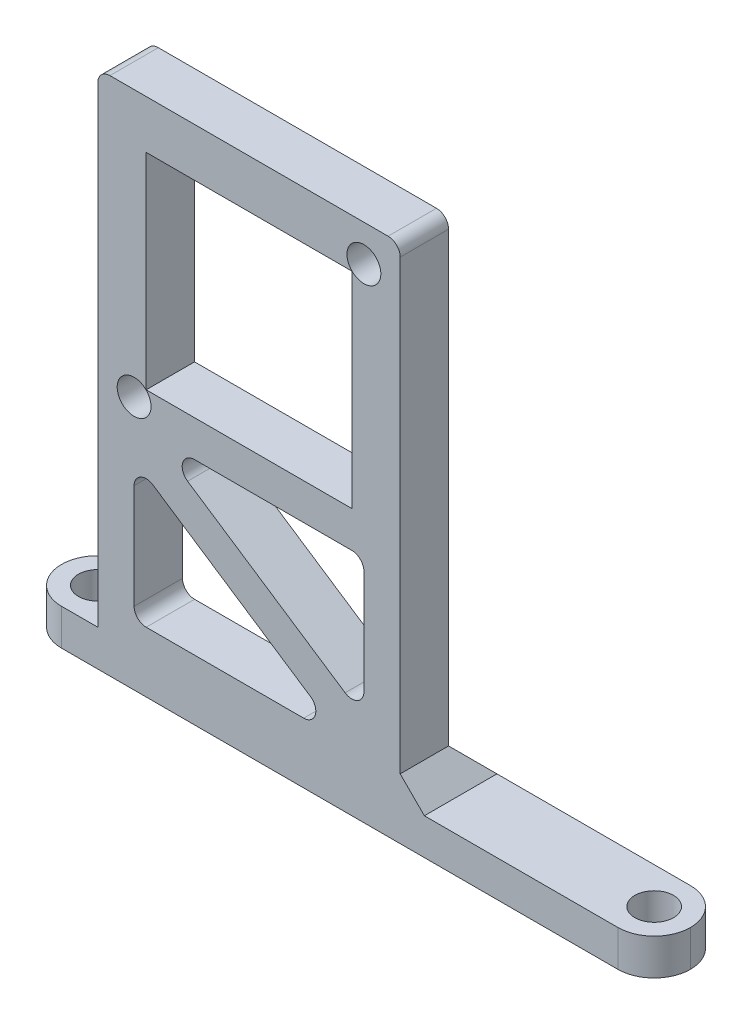
from build123d import *

# Parameters (mm, degrees)
SKETCH1_W           = 52
SKETCH1_H           = 6
BOSS_EXTRUDE1_DEPTH = 3
SKETCH2_W           = 25
SKETCH2_H           = 4
BOSS_EXTRUDE2_DEPTH = 40
SKETCH3_R           = 1.6
CUT_EXTRUDE1_DEPTH  = 48.801673611
FILLET1_R           = 3
SKETCH5_R           = 1.4
CUT_EXTRUDE3_DEPTH  = 51.606323716
SKETCH6_W           = 17
SKETCH6_H           = 17
CUT_EXTRUDE4_DEPTH  = 51.606323716
CHAMFER1_SIZE       = 2
CUT_EXTRUDE5_DEPTH  = 51.408332645
FILLET2_R           = 1


with BuildPart() as part:
    # Sketch1 → Boss-Extrude1 (new body)
    with BuildSketch(Plane(origin=(0, 0, 0), x_dir=(1, 0, 0), z_dir=(0, 1, 0))):
        Rectangle(SKETCH1_W, SKETCH1_H)
    extrude(amount=BOSS_EXTRUDE1_DEPTH)

    # Sketch2 → Boss-Extrude2 (add)
    with BuildSketch(Plane(origin=(0, 3, 0), x_dir=(1, 0, 0), z_dir=(0, 1, 0))):
        with Locations((-7.5, -1)):
            Rectangle(SKETCH2_W, SKETCH2_H)
    extrude(amount=BOSS_EXTRUDE2_DEPTH)

    # Sketch3 → Cut-Extrude1 (cut, through all)
    with BuildSketch(Plane(origin=(0, 3, 0), x_dir=(1, 0, 0), z_dir=(0, 1, 0))):
        with Locations(Location((-23, 0, 0), (0, 0, 270))):
            Circle(SKETCH3_R)
        with Locations(Location((23, 0, 0), (0, 0, 270))):
            Circle(SKETCH3_R)
    extrude(amount=-CUT_EXTRUDE1_DEPTH, mode=Mode.SUBTRACT)

    # Fillet1
    fillet1_edges = [part.edges().sort_by_distance(p)[0] for p in [
        (26, 1.5, -3),
        (26, 1.5, 3),
        (-26, 1.5, 3),
        (-26, 1.5, -3),
    ]]
    fillet(fillet1_edges, radius=FILLET1_R - 0.0001)  # a hair under: the kernel refuses the full size

    # Sketch5 → Cut-Extrude3 (cut, through all)
    with BuildSketch(Plane.XY.offset(3)):
        with Locations((2, 40)):
            Circle(SKETCH5_R)
        with Locations((-17, 21)):
            Circle(SKETCH5_R)
    extrude(amount=-CUT_EXTRUDE3_DEPTH, mode=Mode.SUBTRACT)

    # Sketch6 → Cut-Extrude4 (cut, through all)
    with BuildSketch(Plane.XY.offset(3)):
        with Locations((-7.5, 30.5)):
            Rectangle(SKETCH6_W, SKETCH6_H)
    extrude(amount=-CUT_EXTRUDE4_DEPTH, mode=Mode.SUBTRACT)

    # Chamfer1
    chamfer1_edges = [part.edges().sort_by_distance(p)[0] for p in [
        (5, 3, 1),
        (-7.5, 3, -1),
    ]]
    chamfer(chamfer1_edges, length=CHAMFER1_SIZE - 0.0001)  # a hair under: the kernel refuses the full size

    # Sketch7 → Cut-Extrude5 (cut, through all)
    with BuildSketch(Plane(origin=(0, 0, -1), x_dir=(-1, 0, 0), z_dir=(0, 0, -1))):
        Polygon((-2, 19), (-2, 7.500243065), (15.342054098, 19), align=None)
        Polygon((17, 16.499756935), (-0.342054098, 5), (17, 5), align=None)
    extrude(amount=-CUT_EXTRUDE5_DEPTH, mode=Mode.SUBTRACT)

    # Fillet2
    fillet2_edges = [part.edges().sort_by_distance(p)[0] for p in [
        (-17, 5, 1),
        (-17, 16.499756935, 1),
        (0.342054098, 5, 1),
        (2, 7.500243065, 1),
        (2, 19, 1),
        (-15.342054098, 19, 1),
        (5, 43, 1),
        (-20, 43, 1),
    ]]
    fillet(fillet2_edges, radius=FILLET2_R)


solid = part.part
